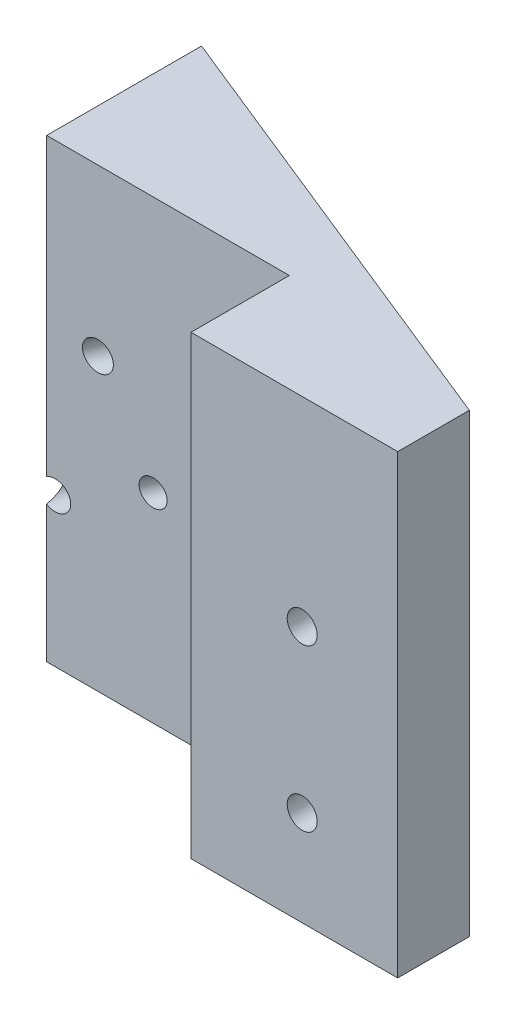
from build123d import *

# Parameters (mm, degrees)
BOSS_EXTRUDE1_DEPTH = 70
SKETCH3_W           = 37.26135862
SKETCH3_H           = 9.1
CUT_EXTRUDE1_DEPTH  = 70
SKETCH4_W           = 31.73864138
SKETCH4_H           = 6
BOSS_EXTRUDE2_DEPTH = 70
SKETCH5_R           = 2.3
CUT_EXTRUDE2_DEPTH  = 20
SKETCH6_R           = 2.2
SKETCH6_R_2         = 2
CUT_EXTRUDE3_DEPTH  = 45


with BuildPart() as part:
    # Sketch1 → Boss-Extrude1 (new body)
    with BuildSketch(Plane(origin=(0, 0, 0), x_dir=(1, 0, 0), z_dir=(0, 1, 0))):
        Polygon((0, 32.877809583), (0, 0), (69, 0), (69, 5), align=None)
    extrude(amount=BOSS_EXTRUDE1_DEPTH)

    # Sketch3 → Cut-Extrude1 (cut)
    with BuildSketch(Plane(origin=(0, 70, 0), x_dir=(1, 0, 0), z_dir=(0, 1, 0))):
        with Locations((18.63067931, 4.55)):
            Rectangle(SKETCH3_W, SKETCH3_H)
    extrude(amount=-CUT_EXTRUDE1_DEPTH, mode=Mode.SUBTRACT)

    # Sketch4 → Boss-Extrude2 (add)
    with BuildSketch(Plane(origin=(0, 70, 0), x_dir=(1, 0, 0), z_dir=(0, 1, 0))):
        with Locations((53.13067931, -3)):
            Rectangle(SKETCH4_W, SKETCH4_H)
    extrude(amount=-BOSS_EXTRUDE2_DEPTH)

    # Sketch5 → Cut-Extrude2 (cut)
    with BuildSketch(Plane.XY.offset(6)):
        with Locations((54.336872709, 39.386266727)):
            Circle(SKETCH5_R)
        with Locations((54.336872709, 14.608663862)):
            Circle(SKETCH5_R)
    extrude(amount=-CUT_EXTRUDE2_DEPTH, mode=Mode.SUBTRACT)

    # Sketch6 → Cut-Extrude3 (cut)
    with BuildSketch(Plane(origin=(11.419422814, 0, -28.264063282), x_dir=(-0.9271838545667899, 0, -0.3746065934159063), z_dir=(0.3746065934159063, 0, -0.9271838545667899))):
        with Locations((10.051044643, 36.733320431)):
            Circle(SKETCH6_R)
        with Locations((2.191528857, 22.796749418)):
            Circle(SKETCH6_R)
        with Locations((-3.885526371, 44.592836217)):
            Circle(SKETCH6_R)
        with Locations((-11.745042157, 30.656265203)):
            Circle(SKETCH6_R_2)
    extrude(amount=-CUT_EXTRUDE3_DEPTH, mode=Mode.SUBTRACT)


solid = part.part
